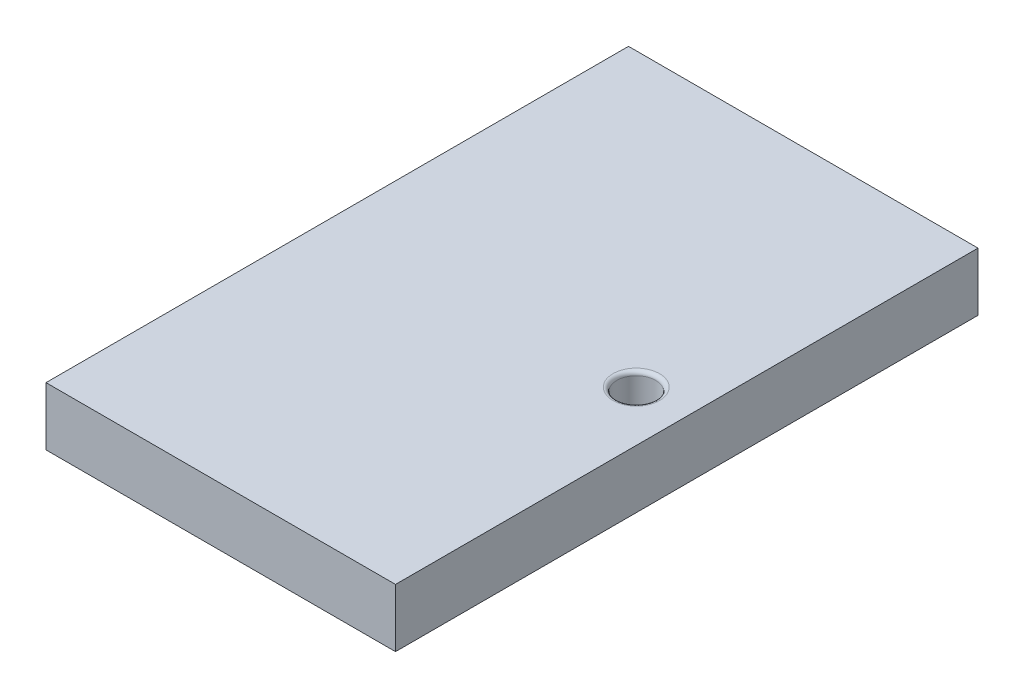
from build123d import *

# Parameters (mm, degrees)
SKETCH_1_W      = 18
SKETCH_1_H      = 30
SKETCH_1_R      = 1
EXTRUDE_1_DEPTH = 3
FILLET_1_R      = 0.2


with BuildPart() as part:
    # 草图1 → 凸台-拉伸1 (new body)
    with BuildSketch(Plane(origin=(0, 0, 0), x_dir=(1, 0, 0), z_dir=(0, 1, 0))):
        with Locations((9, 15)):
            Rectangle(SKETCH_1_W, SKETCH_1_H)
        with Locations((15.4, 15)):
            Circle(SKETCH_1_R, mode=Mode.SUBTRACT)
    extrude(amount=EXTRUDE_1_DEPTH)

    # 圆角1
    fillet_1_edges = [part.edges().sort_by_distance(p)[0] for p in [
        (14.4, 3, -15),
    ]]
    fillet(fillet_1_edges, radius=FILLET_1_R)


solid = part.part
